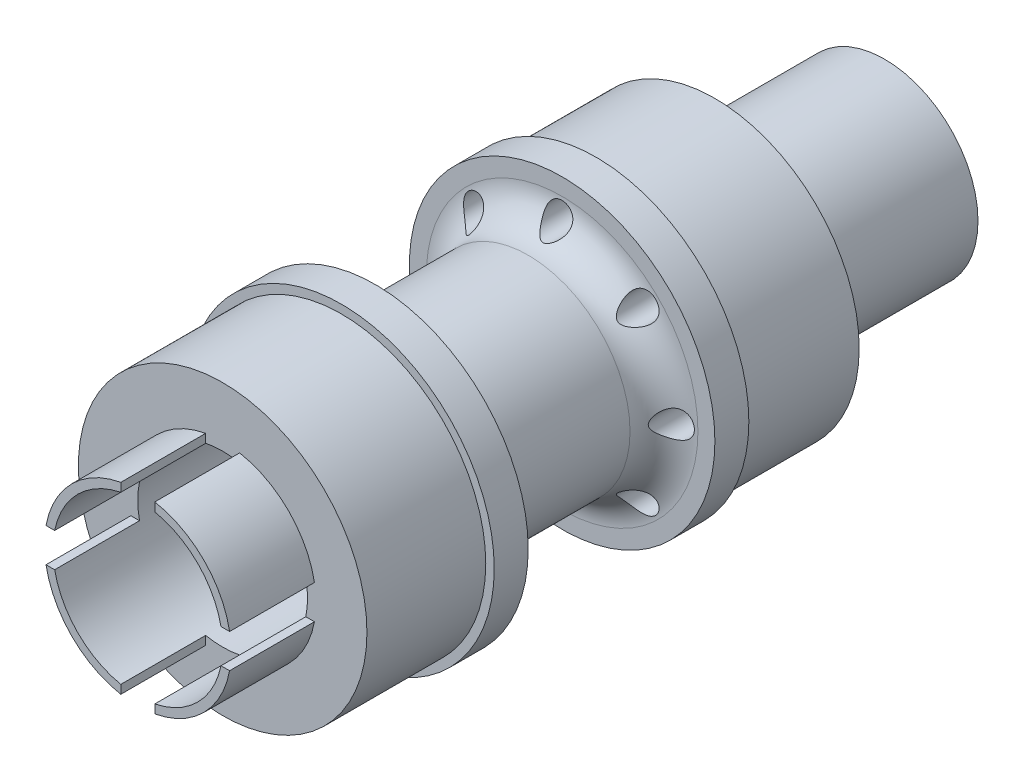
from build123d import *

# Parameters (mm, degrees)
ESQUISSE1_R                                   = 5.5
ESQUISSE1_R_2                                 = 4.5
BOSS_EXTRU_1_DEPTH                            = 10
ESQUISSE3_R                                   = 8.5
ESQUISSE3_R_2                                 = 5
BOSS_EXTRU_3_DEPTH                            = 7
ESQUISSE4_R                                   = 9
ESQUISSE4_R_2                                 = 5
BOSS_EXTRU_4_DEPTH                            = 2
ESQUISSE7_R                                   = 6
ESQUISSE7_R_2                                 = 5
BOSS_EXTRU_7_DEPTH                            = 11
ESQUISSE8_R                                   = 9
ESQUISSE8_R_2                                 = 5
BOSS_EXTRU_8_DEPTH                            = 2
ESQUISSE15_R                                  = 8.5
ESQUISSE15_R_2                                = 5
BOSS_EXTRU_9_DEPTH                            = 7
ESQUISSE16_R                                  = 5.5
ESQUISSE16_R_2                                = 5
BOSS_EXTRU_10_DEPTH                           = 5
ESQUISSE17_W                                  = 20
ESQUISSE17_H                                  = 2
ESQUISSE17_W_2                                = 2
ESQUISSE17_H_2                                = 20
ENL_V_MAT_EXTRU_1_DEPTH                       = 5
TROU_POUR_TARAUDAGE_POUR_TROU_TARAUD_M2_D     = 1.6
TROU_POUR_TARAUDAGE_POUR_TROU_TARAUD_M2_DEPTH = 9
CONG_1_R                                      = 2


with BuildPart() as part:
    # Esquisse1 → Boss.-Extru.1 (new body)
    with BuildSketch(Plane.XY):
        Circle(ESQUISSE1_R)
        Circle(ESQUISSE1_R_2, mode=Mode.SUBTRACT)
    extrude(amount=BOSS_EXTRU_1_DEPTH)

    # Esquisse3 → Boss.-Extru.3 (add)
    with BuildSketch(Plane.XY.offset(10)):
        Circle(ESQUISSE3_R)
        Circle(ESQUISSE3_R_2, mode=Mode.SUBTRACT)
    extrude(amount=BOSS_EXTRU_3_DEPTH)

    # Esquisse4 → Boss.-Extru.4 (add)
    with BuildSketch(Plane.XY.offset(17)):
        Circle(ESQUISSE4_R)
        Circle(ESQUISSE4_R_2, mode=Mode.SUBTRACT)
    extrude(amount=BOSS_EXTRU_4_DEPTH)

    # Esquisse7 → Boss.-Extru.7 (add)
    with BuildSketch(Plane.XY.offset(19)):
        Circle(ESQUISSE7_R)
        Circle(ESQUISSE7_R_2, mode=Mode.SUBTRACT)
    extrude(amount=BOSS_EXTRU_7_DEPTH)

    # Esquisse8 → Boss.-Extru.8 (add)
    with BuildSketch(Plane.XY.offset(30)):
        Circle(ESQUISSE8_R)
        Circle(ESQUISSE8_R_2, mode=Mode.SUBTRACT)
    extrude(amount=BOSS_EXTRU_8_DEPTH)

    # Esquisse15 → Boss.-Extru.9 (add)
    with BuildSketch(Plane.XY.offset(32)):
        Circle(ESQUISSE15_R)
        Circle(ESQUISSE15_R_2, mode=Mode.SUBTRACT)
    extrude(amount=BOSS_EXTRU_9_DEPTH)

    # Esquisse16 → Boss.-Extru.10 (add)
    with BuildSketch(Plane.XY.offset(39)):
        Circle(ESQUISSE16_R)
        Circle(ESQUISSE16_R_2, mode=Mode.SUBTRACT)
    extrude(amount=BOSS_EXTRU_10_DEPTH)

    # Esquisse17 → Enlèv. mat.-Extru.1 (cut)
    with BuildSketch(Plane.XY.offset(44)):
        Rectangle(ESQUISSE17_W, ESQUISSE17_H)
        Rectangle(ESQUISSE17_W_2, ESQUISSE17_H_2)
    extrude(amount=-ENL_V_MAT_EXTRU_1_DEPTH, mode=Mode.SUBTRACT)

    # Trou pour taraudage pour trou taraudé M21
    with Locations(Plane(origin=(0, 0, 10), x_dir=(-1, 0, 0), z_dir=(0, 0, -1))):
        with Locations((-7, 0), (-4.949747468, 4.949747468), (0, 7), (4.949747468, 4.949747468), (7, 0), (4.949747468, -4.949747468), (0, -7), (-4.949747468, -4.949747468), (0, 0)):
            Hole(TROU_POUR_TARAUDAGE_POUR_TROU_TARAUD_M2_D / 2, depth=TROU_POUR_TARAUDAGE_POUR_TROU_TARAUD_M2_DEPTH)

    # Congé1
    # the kernel refuses this fillet: 2 mm, written as the material it adds along each edge
    with BuildSketch(Plane(origin=(0, 0, 30), x_dir=(1, 0, 0), z_dir=(0, -1, 0))) as cong_1_piece_1:
        with BuildLine():
            CenterArc((6 + CONG_1_R, -CONG_1_R), CONG_1_R, 90, 90)
            Line((6 + CONG_1_R, 0), (6, 0))
            Line((6, 0), (6, -CONG_1_R))
        make_face()
    revolve(axis=Axis((0, 0, 30), (0, 0, 1)))
    with BuildSketch(Plane(origin=(0, 0, 19), x_dir=(1, 0, 0), z_dir=(0, -1, 0))) as cong_1_piece_2_section:
        with BuildLine():
            CenterArc((6 + CONG_1_R, CONG_1_R), CONG_1_R, 180, 90)
            Line((6, CONG_1_R), (6, 0))
            Line((6, 0), (6 + CONG_1_R, 0))
        make_face()
    cong_1_piece_2 = revolve(axis=Axis((0, 0, 19), (0, 0, 1)), mode=Mode.PRIVATE)
    cong_1_piece_2 = cong_1_piece_2 - Plane(origin=(-4.949747468, -4.949747468, 19.036420824), x_dir=(1, 0, 0), z_dir=(0, 0, 1)) * Cylinder(0.8, 32, mode=Mode.PRIVATE)
    cong_1_piece_2 = cong_1_piece_2 - Plane(origin=(0, -7, 19.036420824), x_dir=(1, 0, 0), z_dir=(0, 0, 1)) * Cylinder(0.8, 32, mode=Mode.PRIVATE)
    cong_1_piece_2 = cong_1_piece_2 - Plane(origin=(4.949747468, -4.949747468, 19.036420824), x_dir=(1, 0, 0), z_dir=(0, 0, 1)) * Cylinder(0.8, 32, mode=Mode.PRIVATE)
    cong_1_piece_2 = cong_1_piece_2 - Plane(origin=(-7, 0, 19.036420824), x_dir=(1, 0, 0), z_dir=(0, 0, 1)) * Cylinder(0.8, 32, mode=Mode.PRIVATE)
    cong_1_piece_2 = cong_1_piece_2 - Plane(origin=(-4.949747468, 4.949747468, 19.036420824), x_dir=(1, 0, 0), z_dir=(0, 0, 1)) * Cylinder(0.8, 32, mode=Mode.PRIVATE)
    cong_1_piece_2 = cong_1_piece_2 - Plane(origin=(7, 0, 19.036420824), x_dir=(1, 0, 0), z_dir=(0, 0, 1)) * Cylinder(0.8, 32, mode=Mode.PRIVATE)
    cong_1_piece_2 = cong_1_piece_2 - Plane(origin=(0, 7, 19.036420824), x_dir=(1, 0, 0), z_dir=(0, 0, 1)) * Cylinder(0.8, 32, mode=Mode.PRIVATE)
    cong_1_piece_2 = cong_1_piece_2 - Plane(origin=(4.949747468, 4.949747468, 19.036420824), x_dir=(1, 0, 0), z_dir=(0, 0, 1)) * Cylinder(0.8, 32, mode=Mode.PRIVATE)
    add(cong_1_piece_2)


solid = part.part
